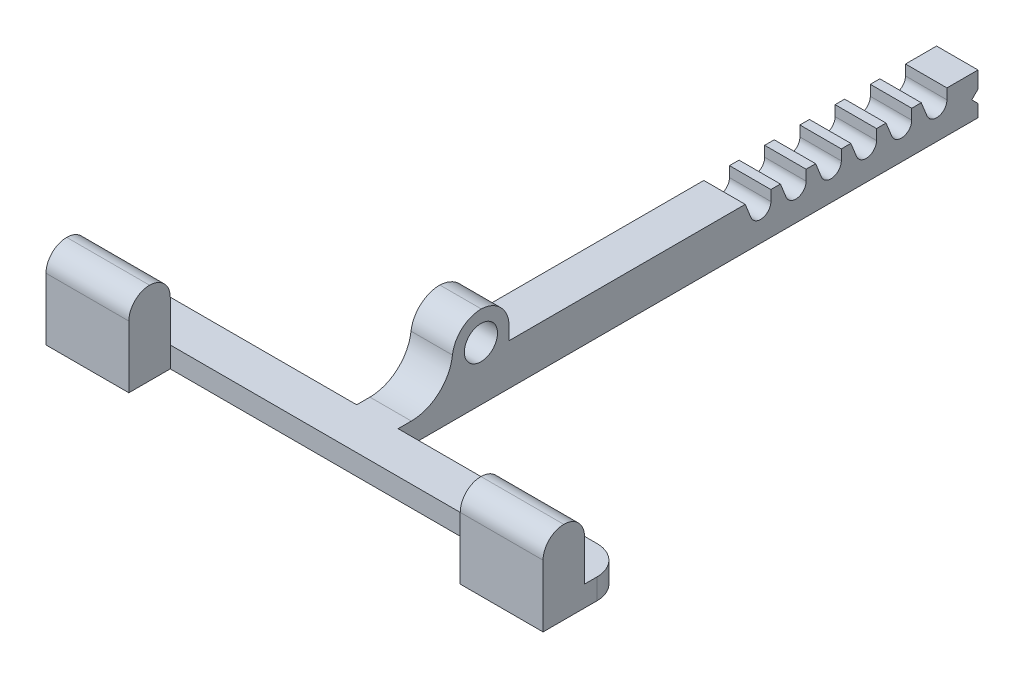
from build123d import *

# Parameters (mm, degrees)
SKETCH1_W           = 20
SKETCH1_H           = 10
SKETCH1_W_2         = 10
SKETCH1_H_2         = 13.195504549
SKETCH1_H_3         = 13.608990902
SKETCH1_H_4         = 113.195504549
BOSS_EXTRUDE1_DEPTH = 5
SKETCH1_3_W         = 20
SKETCH1_3_H         = 10
SKETCH1_3_W_2       = 10
SKETCH1_3_H_2       = 13.608990902
BOSS_EXTRUDE2_DEPTH = 20
SKETCH1_5_W         = 10
SKETCH1_5_H         = 113.195504549
BOSS_EXTRUDE3_DEPTH = 10
SKETCH3_R           = 4
CUT_EXTRUDE1_DEPTH  = 10
FILLET1_R           = 10
FILLET2_R           = 5
FILLET3_R           = 7
FILLET4_R           = 7
FILLET5_R           = 7


# Some blends are built 0.0001 mm under size
with BuildPart() as part:
    # Sketch1 → Boss-Extrude1 (new body)
    with BuildSketch(Plane(origin=(0, 0, 0), x_dir=(1, 0, 0), z_dir=(0, 1, 0))):
        Polygon((60, -8.515763432), (44.667493795, -8.515763432), (40, -8.515763432), (40, -18.515763432), (60, -18.515763432), align=None)
        Polygon((40, -8.515763432), (44.667493795, -8.515763432), (60, -8.515763432), (60, 1.484236568), (5, 1.484236568), (-5, 1.484236568), (-60, 1.484236568), (-60, -8.515763432), (-40, -8.515763432), align=None)
        with Locations((-50, -13.515763432)):
            Rectangle(SKETCH1_W, SKETCH1_H)
        with Locations((0, 8.081988842)):
            Rectangle(SKETCH1_W_2, SKETCH1_H_2)
        with Locations((0, 21.484236568)):
            Rectangle(SKETCH1_W_2, SKETCH1_H_3)
        with Locations((0, 84.886484294)):
            Rectangle(SKETCH1_W_2, SKETCH1_H_4)
    extrude(amount=BOSS_EXTRUDE1_DEPTH)

    # Sketch1<3> → Boss-Extrude2 (add)
    with BuildSketch(Plane(origin=(0, 0, 0), x_dir=(1, 0, 0), z_dir=(0, 1, 0))):
        with Locations((-50, -13.515763432)):
            Rectangle(SKETCH1_3_W, SKETCH1_3_H)
        Polygon((60, -8.515763432), (44.667493795, -8.515763432), (40, -8.515763432), (40, -18.515763432), (60, -18.515763432), align=None)
        with Locations((0, 21.484236568)):
            Rectangle(SKETCH1_3_W_2, SKETCH1_3_H_2)
    extrude(amount=BOSS_EXTRUDE2_DEPTH)

    # Sketch1<5> → Boss-Extrude3 (add)
    with BuildSketch(Plane(origin=(0, 0, 0), x_dir=(1, 0, 0), z_dir=(0, 1, 0))):
        with Locations((0, 84.886484294)):
            Rectangle(SKETCH1_5_W, SKETCH1_5_H)
    extrude(amount=BOSS_EXTRUDE3_DEPTH)

    # Sketch3 → Cut-Extrude1 (cut)
    with BuildSketch(Plane(origin=(5, 0, 0), x_dir=(0, 0, -1), z_dir=(1, 0, 0))):
        with Locations((21.484236568, 13)):
            Circle(SKETCH3_R)
        with BuildLine():
            Line((120.663634314, 6.570050981), (119.289130035, 10))
            Line((119.289130035, 10), (125.484236568, 10))
            Line((125.484236568, 10), (125.484236568, 7.5))
            ThreePointArc((125.484236568, 7.5), (123.457784012, 5.045259114), (120.663634314, 6.570050981))
        make_face()
        with BuildLine():
            Line((133.984236568, 7.5), (133.984236568, 10))
            Line((133.984236568, 10), (127.789130035, 10))
            Line((127.789130035, 10), (129.163634314, 6.570050981))
            ThreePointArc((129.163634314, 6.570050981), (131.957784012, 5.045259114), (133.984236568, 7.5))
        make_face()
        Polygon((141.484236568, 6), (139.984236568, 4.5), (141.484236568, 3), align=None)
        with BuildLine():
            Line((112.163634314, 6.570050981), (110.789130035, 10))
            Line((110.789130035, 10), (116.984236568, 10))
            Line((116.984236568, 10), (116.984236568, 7.5))
            ThreePointArc((116.984236568, 7.5), (114.957784012, 5.045259114), (112.163634314, 6.570050981))
        make_face()
        with BuildLine():
            Line((103.663634314, 6.570050981), (102.289130035, 10))
            Line((102.289130035, 10), (108.484236568, 10))
            Line((108.484236568, 10), (108.484236568, 7.5))
            ThreePointArc((108.484236568, 7.5), (106.457784012, 5.045259114), (103.663634314, 6.570050981))
        make_face()
        with BuildLine():
            Line((95.163634314, 6.570050981), (93.789130035, 10))
            Line((93.789130035, 10), (99.984236568, 10))
            Line((99.984236568, 10), (99.984236568, 7.5))
            ThreePointArc((99.984236568, 7.5), (97.957784012, 5.045259114), (95.163634314, 6.570050981))
        make_face()
        with BuildLine():
            Line((86.663634314, 6.570050981), (85.289130035, 10))
            Line((85.289130035, 10), (91.484236568, 10))
            Line((91.484236568, 10), (91.484236568, 7.5))
            ThreePointArc((91.484236568, 7.5), (89.457784012, 5.045259114), (86.663634314, 6.570050981))
        make_face()
    extrude(amount=-CUT_EXTRUDE1_DEPTH, mode=Mode.SUBTRACT)

    # Fillet1
    fillet1_edges = [part.edges().sort_by_distance(p)[0] for p in [
        (0, 5, -14.679741117),
    ]]
    fillet(fillet1_edges, radius=FILLET1_R)

    # Fillet2
    fillet2_edges = [part.edges().sort_by_distance(p)[0] for p in [
        (-50, 20, 8.515763432),
        (-50, 20, 18.515763432),
        (50, 20, 8.515763432),
        (50, 20, 18.515763432),
    ]]
    fillet(fillet2_edges, radius=FILLET2_R - 0.0001)  # a hair under: the kernel refuses the full size

    # Fillet3
    fillet3_edges = [part.edges().sort_by_distance(p)[0] for p in [
        (0, 20, -14.679741117),
    ]]
    fillet(fillet3_edges, radius=FILLET3_R)

    # Fillet4
    # the kernel refuses this fillet: 7 mm, written as the material it takes off along each edge
    with BuildSketch(Plane(origin=(22.486690858, 20, -28.288732019), x_dir=(0, 0, 1), z_dir=(-1, 0, 0))) as fillet4_piece_1:
        with BuildLine():
            CenterArc((7, -6.994676343), FILLET4_R, 92.234709992, 87.765290008)
            Line((0, -6.994676343), (-0.14, -6.994676343))
            Line((-0.14, -6.994676343), (-0.14, 0))
            Line((-0.14, 0), (0, 0.14))
            ThreePointArc((0, 0.14), (3.363523943, 0.14), (6.721588844, 0.139893527))
            Line((6.721588844, 0.139893527), (6.727047886, 0))
        make_face()
    extrude(amount=44.973381715, mode=Mode.SUBTRACT)

    # Fillet5
    fillet5_edges = [part.edges().sort_by_distance(p)[0] for p in [
        (-60, 2.5, -1.484236568),
        (60, 2.5, -1.484236568),
    ]]
    fillet(fillet5_edges, radius=FILLET5_R)


solid = part.part
